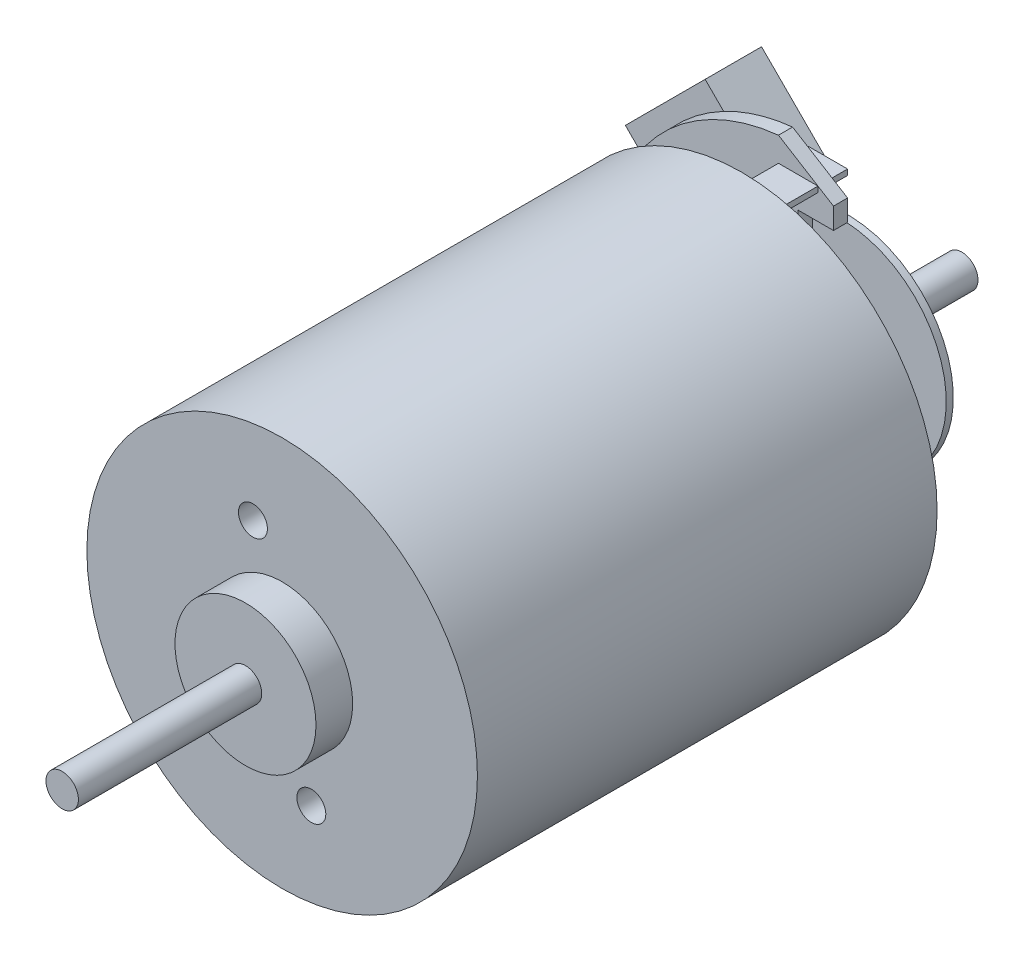
from build123d import *

# Parameters (mm, degrees)
MAINBODY_DEPTH               = 16.3
MAINBODY_DEPTH_BACK          = 16.3
SKETCH1_R                    = 13.85
SKETCH2_R                    = 1.15
OUTPUTSHAFT_DEPTH            = 15.6
SKETCH2_3_R                  = 5
SKETCH2_3_R_2                = 1.15
OUTPUTBOSS_DEPTH             = 2.6
M2_5X0_45_TAPPED_HOLE1_D     = 2.05
M2_5X0_45_TAPPED_HOLE1_DEPTH = 6.35
M2_5X0_45_TAPPED_HOLE1_TIP   = 0.615882135
SKETCH5_W                    = 2.8
SKETCH5_H                    = 0.4
TERMINALS_DEPTH              = 6.1
PCB_START                    = 4
PCB_DEPTH                    = 1
ENCODER_START                = 7
SKETCH9_R                    = 7.5
ENCODER_DEPTH                = 0.5
CONNECTOR_DEPTH              = 4


with BuildPart() as part:
    # Sketch1 → MAINBODY (new, two sides: drawn at the far end of the back side and taken through both)
    with BuildSketch(Plane.XY.offset(-MAINBODY_DEPTH_BACK)):
        Circle(SKETCH1_R)
    extrude(amount=MAINBODY_DEPTH + MAINBODY_DEPTH_BACK)

    # Sketch2 → OUTPUTSHAFT (add)
    with BuildSketch(Plane.XY.offset(16.3)):
        Circle(SKETCH2_R)
    outputshaft = extrude(amount=OUTPUTSHAFT_DEPTH)

    # Sketch2<3> → OUTPUTBOSS (add)
    with BuildSketch(Plane.XY.offset(16.3)):
        Circle(SKETCH2_3_R)
        Circle(SKETCH2_3_R_2, mode=Mode.SUBTRACT)
    outputboss = extrude(amount=OUTPUTBOSS_DEPTH)

    # M2.5x0.45 Tapped Hole1
    with Locations(Plane.XY.offset(16.3)):
        with Locations((-2.070552361, 7.72740661), (2.070552361, -7.72740661)):
            Hole(M2_5X0_45_TAPPED_HOLE1_D / 2, depth=M2_5X0_45_TAPPED_HOLE1_DEPTH)
            with Locations((0, 0, -(M2_5X0_45_TAPPED_HOLE1_DEPTH + M2_5X0_45_TAPPED_HOLE1_TIP / 2))):  # 118° drill point
                Cone(0, M2_5X0_45_TAPPED_HOLE1_D / 2, M2_5X0_45_TAPPED_HOLE1_TIP, mode=Mode.SUBTRACT)

    # REARSHAFT: OUTPUTSHAFT, OUTPUTBOSS across plane
    add(outputshaft.mirror(Plane.XY))
    add(outputboss.mirror(Plane.XY))

    # Sketch5 → TERMINALS (add)
    with BuildSketch(Plane(origin=(0, 0, -16.3), x_dir=(-1, 0, 0), z_dir=(0, 0, -1))):
        with Locations((0, 11.5)):
            Rectangle(SKETCH5_W, SKETCH5_H)
        with Locations((0, -11.5)):
            Rectangle(SKETCH5_W, SKETCH5_H)
    extrude(amount=TERMINALS_DEPTH)

    # Sketch8 → PCB (add)
    with BuildSketch(Plane(origin=(0, 0, -16.3), x_dir=(-1, 0, 0), z_dir=(0, 0, -1)).offset(PCB_START)):
        with BuildLine():
            Line((1.4, 13.427211177), (-2.5, 11.021452752))
            Line((-2.5, 11.021452752), (-2.5, 9.521452752))
            Line((-2.5, 9.521452752), (0, 9.521452752))
            Line((0, 9.521452752), (0, 5))
            ThreePointArc((0, 5), (5, 0), (0, -5))
            Line((0, -5), (0, -9.521452752))
            Line((0, -9.521452752), (-2.5, -9.521452752))
            Line((-2.5, -9.521452752), (-2.5, -11.021452752))
            Line((-2.5, -11.021452752), (1.4, -13.427211177))
            ThreePointArc((1.4, -13.427211177), (13.5, 0), (1.4, 13.427211177))
        make_face()
    extrude(amount=PCB_DEPTH)

    # Sketch9 → ENCODER (add)
    with BuildSketch(Plane(origin=(0, 0, -16.3), x_dir=(-1, 0, 0), z_dir=(0, 0, -1)).offset(ENCODER_START)):
        Circle(SKETCH9_R)
    extrude(amount=ENCODER_DEPTH)

    # Sketch10 → CONNECTOR (add)
    with BuildSketch(Plane(origin=(0, 0, -21.3), x_dir=(-1, 0, 0), z_dir=(0, 0, -1))):
        Polygon((2.651397898, 8.308757211), (8.308252147, 2.651902961), (13.257999616, 7.601650429), (7.601145366, 13.258504679), align=None)
    extrude(amount=CONNECTOR_DEPTH)


solid = part.part
